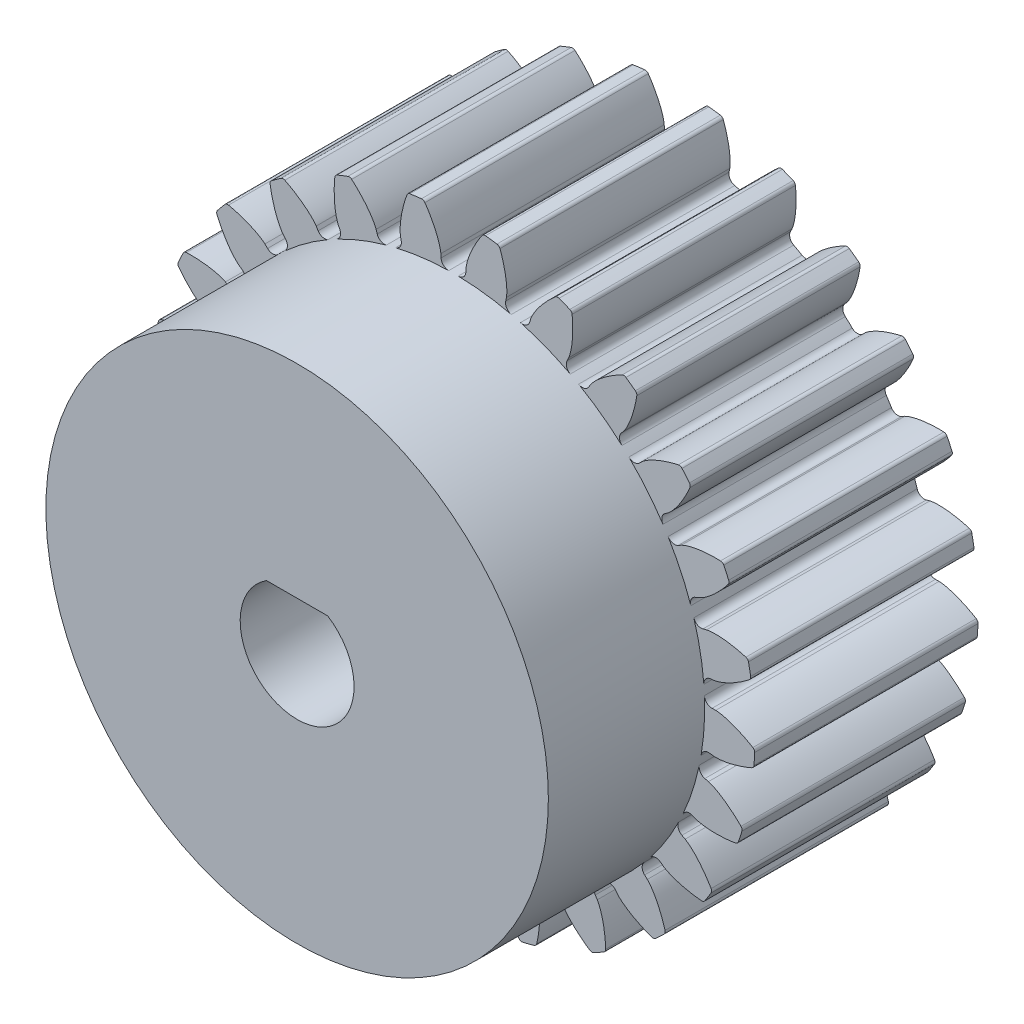
from build123d import *

# Parameters (mm, degrees)
SKETCH1_R                                 = 13.5
BOSS_EXTRUDE1_DEPTH                       = 10
CUT_EXTRUDE_DCLTBC_DEPTH                  = 22.552262062
FILLET_TIP_DCLTBC_R                       = 0.167752518
FILLET_ROOT_DCLTBC_R                      = 0.335505036
CIRPATTERN_DCLTBC_COUNT                   = 25
FILLET_TIP_DCLTBC_OF_CIRPATTERN_DCLTBC_R  = 0.167752518
FILLET_ROOT_DCLTBC_OF_CIRPATTERN_DCLTBC_R = 0.335505036
SKETCH5_R                                 = 11.25
BOSS_EXTRUDE2_DEPTH                       = 7
CUT_EXTRUDE1_DEPTH                        = 26.556970403
CUT_EXTRUDE1_DEPTH_BACK                   = 26.556970403


with BuildPart() as part:
    # Sketch1 → Boss-Extrude1 (new body)
    with BuildSketch(Plane.XY):
        Circle(SKETCH1_R)
    extrude(amount=BOSS_EXTRUDE1_DEPTH)

    # DCLTBC → Cut-Extrude-DCLTBC (cut, through all)
    with BuildSketch(Plane.XY):
        with BuildLine():
            Line((-0.562748114, 11.732669631), (-0.538977631, 11.23708161))
            ThreePointArc((-0.538977631, 11.23708161), (0, 11.25), (0.538977631, 11.23708161))
            Line((0.538977631, 11.23708161), (0.562748114, 11.732669631))
            add(Edge.make_bspline(
                [(0.562748114, 11.732669631), (0.56291499, 11.735451675), (0.563486326, 11.743248781), (0.564974304, 11.757965333), (0.567981121, 11.781937249), (0.572662623, 11.81241378), (0.579688996, 11.851716286), (0.589219602, 11.897889697), (0.601005033, 11.948487589), (0.615240566, 12.003364282), (0.630690866, 12.057948352), (0.647263422, 12.112235565), (0.664817517, 12.166159768), (0.687314139, 12.231284844), (0.716002347, 12.309097989), (0.752023037, 12.399613319), (0.795807792, 12.501732598), (0.843556231, 12.605191963), (0.893104654, 12.706474476), (0.946102743, 12.808167254), (0.99946078, 12.906104479), (1.057875502, 13.007129207), (1.11331821, 13.100025921), (1.178729375, 13.203282854), (1.232480255, 13.286375822), (1.290741317, 13.371497003), (1.319500574, 13.412819424), (1.334367989, 13.43389229)],
                knots=[0, 0, 0, 0, 0, 0.005376749, 0.015083688, 0.02853182, 0.04661014, 0.064854849, 0.092110526, 0.119476176, 0.146842496, 0.174208854, 0.201574956, 0.228941013, 0.256307345, 0.307035032, 0.361767352, 0.416499661, 0.471231937, 0.525964282, 0.580696616, 0.635428982, 0.690161387, 0.744893688, 0.799626082, 0.854358407, 0.909090914, 0.909090914, 0.909090914, 0.909090914, 0.909090914], degree=4))
            ThreePointArc((1.334367989, 13.43389229), (0, 13.5), (-1.334367989, 13.43389229))
            add(Edge.make_bspline(
                [(-0.562748114, 11.732669631), (-0.56291499, 11.735451675), (-0.563486326, 11.743248781), (-0.564974304, 11.757965333), (-0.567981121, 11.781937249), (-0.572662623, 11.81241378), (-0.579688996, 11.851716286), (-0.589219602, 11.897889697), (-0.601005033, 11.948487589), (-0.615240566, 12.003364282), (-0.630690866, 12.057948352), (-0.647263422, 12.112235565), (-0.664817517, 12.166159768), (-0.687314139, 12.231284844), (-0.716002347, 12.309097989), (-0.752023037, 12.399613319), (-0.795807792, 12.501732598), (-0.843556231, 12.605191963), (-0.893104654, 12.706474476), (-0.946102743, 12.808167254), (-0.99946078, 12.906104479), (-1.057875502, 13.007129207), (-1.11331821, 13.100025921), (-1.178729375, 13.203282854), (-1.232480255, 13.286375822), (-1.290741317, 13.371497003), (-1.319500574, 13.412819424), (-1.334367989, 13.43389229)],
                knots=[0, 0, 0, 0, 0, 0.005376749, 0.015083688, 0.02853182, 0.04661014, 0.064854849, 0.092110526, 0.119476176, 0.146842496, 0.174208854, 0.201574956, 0.228941013, 0.256307345, 0.307035032, 0.361767352, 0.416499661, 0.471231937, 0.525964282, 0.580696616, 0.635428982, 0.690161387, 0.744893688, 0.799626082, 0.854358407, 0.909090914, 0.909090914, 0.909090914, 0.909090914, 0.909090914], degree=4))
        make_face()
    cut_extrude_dcltbc = extrude(amount=CUT_EXTRUDE_DCLTBC_DEPTH, mode=Mode.SUBTRACT)

    # Fillet-Tip-DCLTBC
    fillet_tip_dcltbc_edges = [part.edges().sort_by_distance(p)[0] for p in [
        (1.334367989, 13.43389229, 5),
        (-1.334367989, 13.43389229, 5),
    ]]
    fillet(fillet_tip_dcltbc_edges, radius=FILLET_TIP_DCLTBC_R)

    # Fillet-Root-DCLTBC
    fillet_root_dcltbc_edges = [part.edges().sort_by_distance(p)[0] for p in [
        (-0.538977631, 11.23708161, 5),
        (0.538977631, 11.23708161, 5),
    ]]
    fillet(fillet_root_dcltbc_edges, radius=FILLET_ROOT_DCLTBC_R)

    # CirPattern-DCLTBC: Cut-Extrude-DCLTBC ×25 about axis
    cirpattern_dcltbc_axis = Axis((0, 0, 10), (0, 0, 1))
    for i in range(1, CIRPATTERN_DCLTBC_COUNT):
        add(cut_extrude_dcltbc.rotate(cirpattern_dcltbc_axis, i * 360 / CIRPATTERN_DCLTBC_COUNT), mode=Mode.SUBTRACT)

    # Fillet-Tip-DCLTBC of CirPattern-DCLTBC
    fillet_tip_dcltbc_of_cirpattern_dcltbc_edges = [part.edges().sort_by_distance(p)[0] for p in [
        (-2.048426793, 13.343685685, 5),
        (-4.633319522, 12.679998036, 5),
        (-5.302511386, 12.415046234, 5),
        (-7.641142551, 11.129372872, 5),
        (-8.223419688, 10.706323769, 5),
        (-10.16884449, 8.879448279, 5),
        (-10.627620286, 8.324883606, 5),
        (-12.057600532, 6.071595294, 5),
        (-12.364048417, 5.420360389, 5),
        (-13.188733187, 2.882241648, 5),
        (-13.323597913, 2.175255994, 5),
        (-13.491169232, -0.488213842, 5),
        (-13.445976752, -1.206527734, 5),
        (-12.945905497, -3.82799306, 5),
        (-12.723495421, -4.512500888, 5),
        (-11.587202907, -6.927245396, 5),
        (-11.201550079, -7.534937016, 5),
        (-9.500433745, -9.591233428, 5),
        (-8.975770149, -10.083925339, 5),
        (-6.81671739, -11.652568988, 5),
        (-6.18600957, -11.999303547, 5),
        (-3.704681611, -12.981730785, 5),
        (-3.007559259, -13.160721382, 5),
        (-0.359867062, -13.495202692, 5),
        (0.359867062, -13.495202692, 5),
        (3.007559259, -13.160721382, 5),
        (3.704681611, -12.981730785, 5),
        (6.18600957, -11.999303547, 5),
        (6.81671739, -11.652568988, 5),
        (8.975770149, -10.083925339, 5),
        (9.500433745, -9.591233428, 5),
        (11.201550079, -7.534937016, 5),
        (11.587202907, -6.927245396, 5),
        (12.723495421, -4.512500888, 5),
        (12.945905497, -3.82799306, 5),
        (13.445976752, -1.206527734, 5),
        (13.491169232, -0.488213842, 5),
        (13.323597913, 2.175255994, 5),
        (13.188733187, 2.882241648, 5),
        (12.364048417, 5.420360389, 5),
        (12.057600532, 6.071595294, 5),
        (10.627620286, 8.324883606, 5),
        (10.16884449, 8.879448279, 5),
        (8.223419688, 10.706323769, 5),
        (7.641142551, 11.129372872, 5),
        (5.302511386, 12.415046234, 5),
        (4.633319522, 12.679998036, 5),
        (2.048426793, 13.343685685, 5),
    ]]
    fillet(fillet_tip_dcltbc_of_cirpattern_dcltbc_edges, radius=FILLET_TIP_DCLTBC_OF_CIRPATTERN_DCLTBC_R)

    # Fillet-Root-DCLTBC of CirPattern-DCLTBC
    fillet_root_dcltbc_of_cirpattern_dcltbc_edges = [part.edges().sort_by_distance(p)[0] for p in [
        (-3.316593215, 10.750009742, 5),
        (-2.2725039, 11.018086314, 5),
        (-5.88581505, 9.587475225, 5),
        (-4.941195654, 10.106784133, 5),
        (-8.085209479, 7.82252438, 5),
        (-7.299413912, 8.560435535, 5),
        (-9.776580461, 5.566055559, 5),
        (-9.198983148, 6.476203289, 5),
        (-10.853652937, 2.959850997, 5),
        (-10.520546442, 3.985047373, 5),
        (-11.248750482, 0.167668111, 5),
        (-11.181065111, 1.243496274, 5),
        (-10.937047664, -2.635049979, 5),
        (-11.139036338, -1.576188269, 5),
        (-9.938129918, -5.272198188, 5),
        (-10.397100945, -4.296835106, 5),
        (-8.314762919, -7.578074795, 5),
        (-9.001877463, -6.747495991, 5),
        (-6.168948786, -9.407793093, 5),
        (-7.041032912, -8.774186887, 5),
        (-3.635516914, -10.64638515, 5),
        (-4.637774369, -10.249563352, 5),
        (-0.873652143, -11.216025675, 5),
        (-1.943107405, -11.080922056, 5),
        (1.943107405, -11.080922056, 5),
        (0.873652143, -11.216025675, 5),
        (4.637774369, -10.249563352, 5),
        (3.635516914, -10.64638515, 5),
        (7.041032912, -8.774186887, 5),
        (6.168948786, -9.407793093, 5),
        (9.001877463, -6.747495991, 5),
        (8.314762919, -7.578074795, 5),
        (10.397100945, -4.296835106, 5),
        (9.938129918, -5.272198188, 5),
        (11.139036338, -1.576188269, 5),
        (10.937047664, -2.635049979, 5),
        (11.181065111, 1.243496274, 5),
        (11.248750482, 0.167668111, 5),
        (10.520546442, 3.985047373, 5),
        (10.853652937, 2.959850997, 5),
        (9.198983148, 6.476203289, 5),
        (9.776580461, 5.566055559, 5),
        (7.299413912, 8.560435535, 5),
        (8.085209479, 7.82252438, 5),
        (4.941195654, 10.106784133, 5),
        (5.88581505, 9.587475225, 5),
        (2.2725039, 11.018086314, 5),
        (3.316593215, 10.750009742, 5),
    ]]
    fillet(fillet_root_dcltbc_of_cirpattern_dcltbc_edges, radius=FILLET_ROOT_DCLTBC_OF_CIRPATTERN_DCLTBC_R)

    # Sketch5 → Boss-Extrude2 (add)
    with BuildSketch(Plane.XY.offset(10)):
        Circle(SKETCH5_R)
    extrude(amount=BOSS_EXTRUDE2_DEPTH)

    # Sketch6 → Cut-Extrude1 (cut, two sides: drawn at the far end of the back side and taken through both)
    with BuildSketch(Plane(origin=(0, 0, 0), x_dir=(-1, 0, 0), z_dir=(0, 0, -1)).offset(-CUT_EXTRUDE1_DEPTH_BACK)):
        with BuildLine():
            Line((-1.37113086, 2.150000038), (1.37113086, 2.150000038))
            ThreePointArc((1.37113086, 2.150000038), (0, -2.55), (-1.37113086, 2.150000038))
        make_face()
    extrude(amount=CUT_EXTRUDE1_DEPTH + CUT_EXTRUDE1_DEPTH_BACK, mode=Mode.SUBTRACT)


solid = part.part
